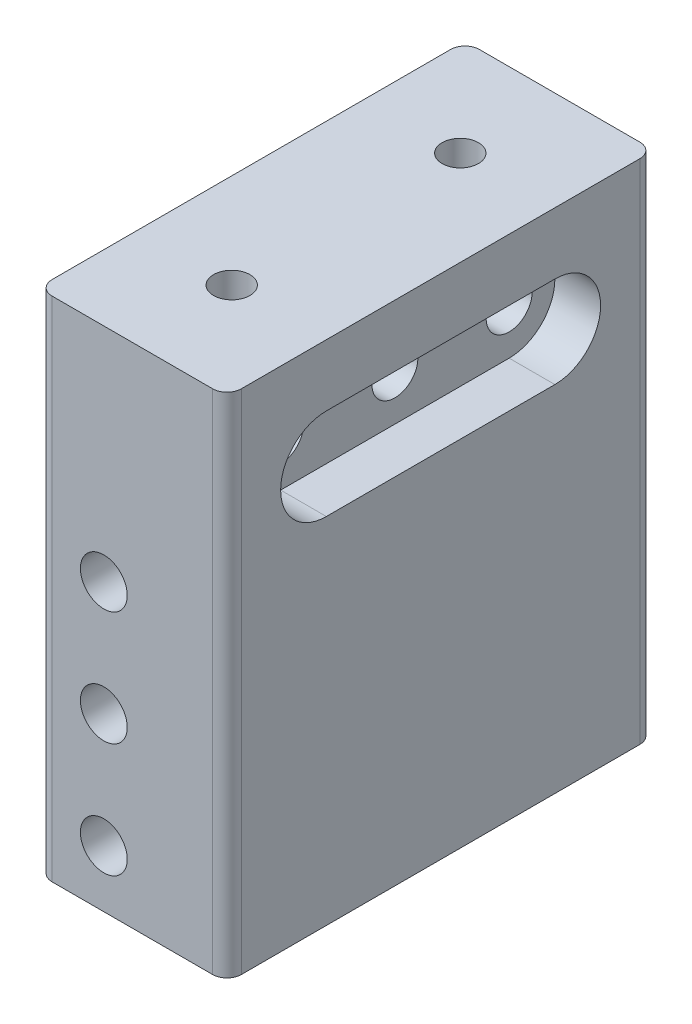
from build123d import *

# Parameters (mm, degrees)
SKETCH1_W           = 21.0312
SKETCH1_H           = 47.4853
BOSS_EXTRUDE1_DEPTH = 25.4
SKETCH2_R           = 2.6035
CUT_EXTRUDE1_DEPTH  = 55.868857829
SKETCH4_R           = 2.5527
CUT_EXTRUDE3_DEPTH  = 41.634773316
FILLET1_R           = 1.5875
CUT_EXTRUDE5_DEPTH  = 5.08
BOSS_EXTRUDE2_DEPTH = 5.588
SKETCH9_R           = 2.0193
CUT_EXTRUDE6_DEPTH  = 5.08


with BuildPart() as part:
    # Sketch1 → Boss-Extrude1 (new, symmetric)
    with BuildSketch(Plane(origin=(0, 0, 0), x_dir=(1, 0, 0), z_dir=(0, 1, 0))):
        Rectangle(SKETCH1_W, SKETCH1_H)
    extrude(amount=BOSS_EXTRUDE1_DEPTH, both=True)

    # Sketch2 → Cut-Extrude1 (cut, through all)
    with BuildSketch(Plane.XY.offset(23.74265)):
        with Locations((-3.175, -6.35)):
            Circle(SKETCH2_R)
        with Locations((-3.175, 6.35)):
            Circle(SKETCH2_R)
        with Locations((-3.175, -19.05)):
            Circle(SKETCH2_R)
    extrude(amount=-CUT_EXTRUDE1_DEPTH, mode=Mode.SUBTRACT)

    # Sketch4 → Cut-Extrude3 (cut, through all)
    with BuildSketch(Plane(origin=(10.5156, 0, 0), x_dir=(0, 0, -1), z_dir=(1, 0, 0))):
        with Locations((-12.7, 19.05)):
            Circle(SKETCH4_R)
        with Locations((12.7, 19.05)):
            Circle(SKETCH4_R)
        with Locations((0, 19.05)):
            Circle(SKETCH4_R)
    extrude(amount=-CUT_EXTRUDE3_DEPTH, mode=Mode.SUBTRACT)

    # Fillet1
    fillet1_edges = [part.edges().sort_by_distance(p)[0] for p in [
        (10.5156, 0, 23.74265),
        (-10.5156, 0, 23.74265),
        (-10.5156, 0, -23.74265),
        (10.5156, 0, -23.74265),
    ]]
    fillet(fillet1_edges, radius=FILLET1_R)

    # Sketch7 → Cut-Extrude5 (cut)
    with BuildSketch(Plane(origin=(10.5156, 0, 0), x_dir=(0, 0, -1), z_dir=(1, 0, 0))):
        with BuildLine():
            Line((-12.7, 24.13), (12.7, 24.13))
            ThreePointArc((12.7, 24.13), (17.78, 19.05), (12.7, 13.97))
            Line((12.7, 13.97), (-12.7, 13.97))
            ThreePointArc((-12.7, 13.97), (-17.78, 19.05), (-12.7, 24.13))
        make_face()
    extrude(amount=-CUT_EXTRUDE5_DEPTH, mode=Mode.SUBTRACT)

    # Sketch8 → Boss-Extrude2 (add)
    with BuildSketch(Plane(origin=(0, 25.4, 0), x_dir=(1, 0, 0), z_dir=(0, 1, 0))):
        with BuildLine():
            Line((-8.9281, -23.74265), (8.9281, -23.74265))
            ThreePointArc((8.9281, -23.74265), (10.050632015, -23.277682015), (10.5156, -22.15515))
            Line((10.5156, -22.15515), (10.5156, 22.15515))
            ThreePointArc((10.5156, 22.15515), (10.050632015, 23.277682015), (8.9281, 23.74265))
            Line((8.9281, 23.74265), (-8.9281, 23.74265))
            ThreePointArc((-8.9281, 23.74265), (-10.050632015, 23.277682015), (-10.5156, 22.15515))
            Line((-10.5156, 22.15515), (-10.5156, -22.15515))
            ThreePointArc((-10.5156, -22.15515), (-10.050632015, -23.277682015), (-8.9281, -23.74265))
        make_face()
    extrude(amount=BOSS_EXTRUDE2_DEPTH)

    # Sketch9 → Cut-Extrude6 (cut)
    with BuildSketch(Plane(origin=(0, 30.988, 0), x_dir=(1, 0, 0), z_dir=(0, 1, 0))):
        with Locations((0, 12.7)):
            Circle(SKETCH9_R)
        with Locations((0, -12.7)):
            Circle(SKETCH9_R)
    extrude(amount=-CUT_EXTRUDE6_DEPTH, mode=Mode.SUBTRACT)


solid = part.part
